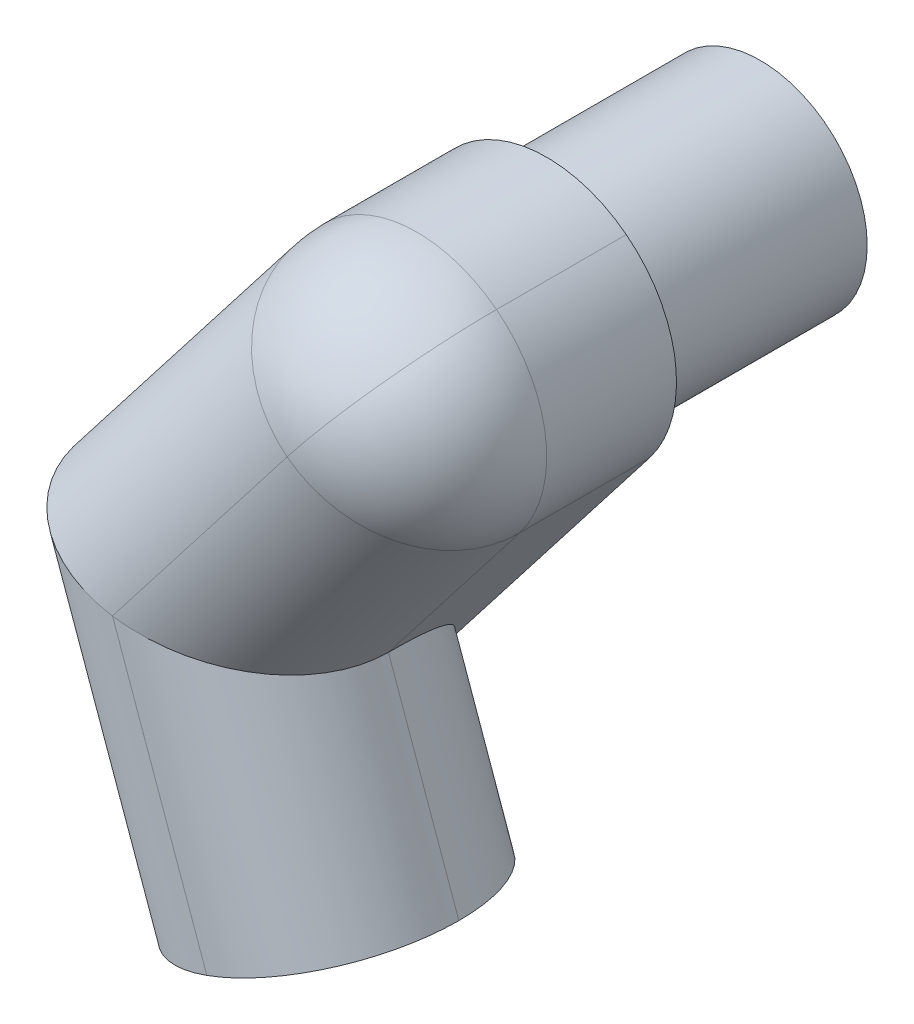
from build123d import *

# Parameters (mm, degrees)
BOSS_EXTRUDE1_DEPTH = 123.444
FILLET1_R           = 61.722
FILLET2_R           = 61.722
SKETCH3_R           = 50.800000000000004
BOSS_EXTRUDE2_DEPTH = 101.6
SKETCH4_R           = 50.8
CUT_EXTRUDE1_DEPTH  = 101.6


with BuildPart() as part:
    # Sketch1 → Boss-Extrude1 (new body)
    with BuildSketch(Plane.XY):
        Polygon((-61.2603734439835, -19.761410788381728), (38.88466731371064, 109.25427234990879), (-58.62951931958517, 184.9471025337958), (-200.27811700244362, 2.4628730865096857), (-144.02441960258417, -155.04747963309688), (-27.772031067671065, -113.52876944205649), align=None)
    extrude(amount=BOSS_EXTRUDE1_DEPTH)

    # Fillet1
    fillet1_edges = [part.edges().sort_by_distance(p)[0] for p in [
        (-44.51620225582728, -66.6450901152191, 123.444),
        (-172.1512683025139, -76.2923032732936, 123.444),
        (-172.1512683025139, -76.2923032732936, 0),
        (-44.51620225582728, -66.6450901152191, 0),
        (-11.187853065136423, 44.74643078076353, 123.444),
        (-129.4538181610144, 93.70498781015274, 123.444),
    ]]
    fillet(fillet1_edges, radius=FILLET1_R - 0.0001)  # a hair under: the kernel refuses the full size

    # Fillet2
    fillet2_edges = [part.edges().sort_by_distance(p)[0] for p in [
        (-58.62951931958517, 184.9471025337958, 30.861050000000017),
        (38.88466731371064, 109.25427234990879, 30.86105000000001),
        (24.604068449214424, 120.33921272724501, 105.36607403771798),
        (-44.34892045508896, 173.86216215645953, 105.366074037718),
    ]]
    fillet(fillet2_edges, radius=FILLET2_R - 0.0001)  # a hair under: the kernel refuses the full size

    # Sketch3 → Boss-Extrude2 (add)
    with BuildSketch(Plane(origin=(0, 0, 0), x_dir=(-1, 0, 0), z_dir=(0, 0, -1))):
        with Locations(Location((47.71884109488077, 98.3435941252044, 0), (0, 0, 180))):
            Circle(SKETCH3_R)
    extrude(amount=BOSS_EXTRUDE2_DEPTH)

    # Sketch4 → Cut-Extrude1 (cut)
    with BuildSketch(Plane(origin=(32.81770626358453, -91.88957753803668, 0), x_dir=(0.9417419115948374, 0.3363363969981563, 0), z_dir=(0.3363363969981563, -0.9417419115948374, 0))):
        with Locations((-126.05994289631548, 61.722)):
            Circle(SKETCH4_R)
    extrude(amount=-CUT_EXTRUDE1_DEPTH, mode=Mode.SUBTRACT)


solid = part.part
